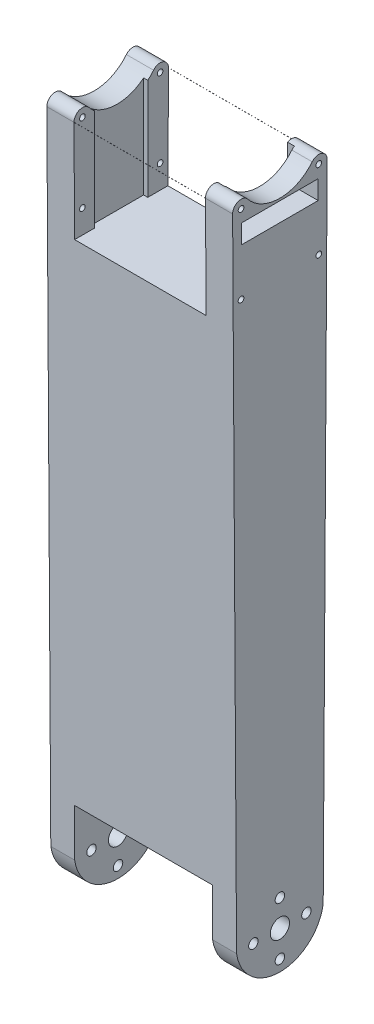
from build123d import *

# Parameters (mm, degrees)
BOSS_EXTRUDE1_DEPTH      = 24.511
BOSS_EXTRUDE1_DEPTH_BACK = 24.511
CUT_EXTRUDE3_DEPTH       = 212.61733137
CUT_EXTRUDE3_DEPTH_BACK  = 212.61733137
SKETCH3_4_R              = 1.250061
SKETCH3_4_R_2            = 0.750062
SKETCH3_4_R_3            = 2.54
CUT_EXTRUDE4_DEPTH       = 18.2000017
CUT_EXTRUDE4_DEPTH_BACK  = 18.2000017
SKETCH4_W                = 23.01416747
SKETCH4_H                = 23.93
CUT_EXTRUDE5_DEPTH       = 17.3500034
CUT_EXTRUDE5_DEPTH_BACK  = 17.3500034
SKETCH4_4_W              = 24.944915852
SKETCH4_4_H              = 29.1224716
SKETCH5_W                = 20.2
SKETCH5_H                = 5
CUT_EXTRUDE6_DEPTH       = 18.2000017
SKETCH5_3_W              = 18.4
SKETCH5_3_H              = 13.35
CUT_EXTRUDE7_DEPTH       = 1.7999964
SKETCH6_W                = 13.9999974
SKETCH6_H                = 29.1224716
CUT_EXTRUDE8_DEPTH       = 1.0999978
CUT_EXTRUDE10_DEPTH      = 212.61733137
CUT_EXTRUDE10_DEPTH_BACK = 212.61733137


with BuildPart() as part:
    # Sketch3 → Boss-Extrude1 (new, two sides: drawn at the far end of the back side and taken through both)
    with BuildSketch(Plane(origin=(0, 0, 0), x_dir=(0, 0, -1), z_dir=(1, 0, 0)).offset(-BOSS_EXTRUDE1_DEPTH_BACK)):
        with BuildLine():
            Line((-11.429783892, 38.029713575), (-12.472457926, 207.586478685))
            ThreePointArc((-12.472457926, 207.586478685), (-10.998297042, 209.692884773), (-8.522757463, 208.998766114))
            ThreePointArc((-8.522757463, 208.998766114), (0, 204.933486246), (8.522757463, 208.998766114))
            ThreePointArc((8.522757463, 208.998766114), (10.998297042, 209.692884773), (12.472457926, 207.586478685))
            Line((12.472457926, 207.586478685), (11.429783892, 38.029713575))
            ThreePointArc((11.429783892, 38.029713575), (0, 26.67), (-11.429783892, 38.029713575))
        make_face()
    extrude(amount=BOSS_EXTRUDE1_DEPTH + BOSS_EXTRUDE1_DEPTH_BACK)

    # Sketch3<4> → Cut-Extrude3 (cut, two sides: drawn at the far end of the back side and taken through both)
    with BuildSketch(Plane(origin=(0, 0, 0), x_dir=(0, 0, -1), z_dir=(1, 0, 0)).offset(-CUT_EXTRUDE3_DEPTH_BACK)):
        with Locations((0, 45.099986)):
            Circle(SKETCH3_4_R)
        with Locations((6.999986, 38.1)):
            Circle(SKETCH3_4_R)
        with Locations((0, 31.100014)):
            Circle(SKETCH3_4_R)
        with Locations((-6.999986, 38.1)):
            Circle(SKETCH3_4_R)
        with Locations((-10.249999947, 186.90016149)):
            Circle(SKETCH3_4_R_2)
        with Locations((10.249999947, 186.90016149)):
            Circle(SKETCH3_4_R_2)
        with Locations((10.249999947, 207.60014549)):
            Circle(SKETCH3_4_R_2)
        with Locations((-10.249999947, 207.60014549)):
            Circle(SKETCH3_4_R_2)
        with Locations((0, 38.1)):
            Circle(SKETCH3_4_R_3)
    extrude(amount=CUT_EXTRUDE3_DEPTH + CUT_EXTRUDE3_DEPTH_BACK, mode=Mode.SUBTRACT)

    # Sketch4 → Cut-Extrude4 (cut, two sides: drawn at the far end of the back side and taken through both)
    with BuildSketch(Plane(origin=(0, 0, 0), x_dir=(0, 0, -1), z_dir=(1, 0, 0)).offset(-CUT_EXTRUDE4_DEPTH_BACK)):
        with Locations((0, 38.635)):
            Rectangle(SKETCH4_W, SKETCH4_H)
    extrude(amount=CUT_EXTRUDE4_DEPTH + CUT_EXTRUDE4_DEPTH_BACK, mode=Mode.SUBTRACT)

    # Sketch4<4> → Cut-Extrude5 (cut, two sides: drawn at the far end of the back side and taken through both)
    with BuildSketch(Plane(origin=(0, 0, 0), x_dir=(0, 0, -1), z_dir=(1, 0, 0)).offset(-CUT_EXTRUDE5_DEPTH_BACK)):
        with Locations((0, 195.26140969)):
            Rectangle(SKETCH4_4_W, SKETCH4_4_H)
    extrude(amount=CUT_EXTRUDE5_DEPTH + CUT_EXTRUDE5_DEPTH_BACK, mode=Mode.SUBTRACT)

    # Sketch5 → Cut-Extrude6 (cut)
    with BuildSketch(Plane.ZY.offset(-17.3500034)):
        with Locations((5.3e-08, 201.85014549)):
            Rectangle(SKETCH5_W, SKETCH5_H)
    extrude(amount=-CUT_EXTRUDE6_DEPTH, mode=Mode.SUBTRACT)

    # Sketch5<3> → Cut-Extrude7 (cut)
    with BuildSketch(Plane.ZY.offset(-17.3500034)):
        with BuildLine():
            Line((-9.199999947, 209.558973264), (-9.199999947, 204.35014549))
            Line((-9.199999947, 204.35014549), (9.200000053, 204.35014549))
            Line((9.200000053, 204.35014549), (9.200000053, 209.558973321))
            ThreePointArc((9.200000053, 209.558973321), (8.833410085, 209.31268145), (8.522757463, 208.998766114))
            ThreePointArc((8.522757463, 208.998766114), (0, 204.933486246), (-8.522757463, 208.998766114))
            ThreePointArc((-8.522757463, 208.998766114), (-8.833410039, 209.312681412), (-9.199999947, 209.558973264))
        make_face()
        with Locations((5.3e-08, 192.67514549)):
            Rectangle(SKETCH5_3_W, SKETCH5_3_H)
    extrude(amount=-CUT_EXTRUDE7_DEPTH, mode=Mode.SUBTRACT)

    # Sketch6 → Cut-Extrude8 (cut)
    with BuildSketch(Plane(origin=(-17.3500034, 0, 0), x_dir=(0, 0, -1), z_dir=(1, 0, 0))):
        with Locations((0, 195.26140969)):
            Rectangle(SKETCH6_W, SKETCH6_H)
    extrude(amount=-CUT_EXTRUDE8_DEPTH, mode=Mode.SUBTRACT)

    # Sketch3<5> → Cut-Extrude10 (cut, two sides: drawn at the far end of the back side and taken through both)
    with BuildSketch(Plane(origin=(0, 0, 0), x_dir=(0, 0, -1), z_dir=(1, 0, 0)).offset(-CUT_EXTRUDE10_DEPTH_BACK)):
        with BuildLine():
            ThreePointArc((0, 28.10002), (-7.57031661, 30.929140969), (-11.429783892, 38.029713575))
            ThreePointArc((-11.429783892, 38.029713575), (0, 26.67), (11.429783892, 38.029713575))
            ThreePointArc((11.429783892, 38.029713575), (7.57031661, 30.929140969), (0, 28.10002))
        make_face()
    extrude(amount=CUT_EXTRUDE10_DEPTH + CUT_EXTRUDE10_DEPTH_BACK, mode=Mode.SUBTRACT)


solid = part.part
